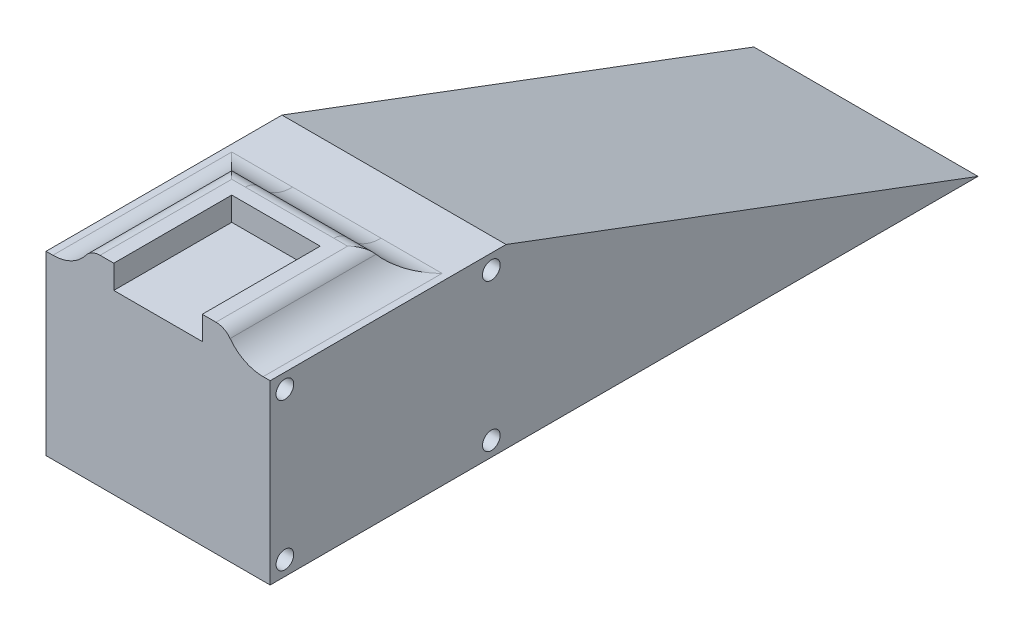
from build123d import *

# Parameters (mm, degrees)
BOSS_EXTRUDE1_DEPTH                = 38
F_3_0_3_DIAMETER_HOLE1_D           = 3
F_3_0_3_DIAMETER_HOLE1_CSINK_D     = 3.05
F_3_0_3_DIAMETER_HOLE1_CSINK_ANGLE = 90
SKETCH6_W                          = 4
SKETCH6_H                          = 4
BOSS_EXTRUDE2_DEPTH                = 24
FILLET2_R                          = 7
FILLET3_START                      = 7.489649075
FILLET3_DEPTH                      = 4
FILLET3_START_2                    = 26.489649075
FILLET3_2_DEPTH                    = 4
FILLET3_START_3                    = 1.165093755
FILLET3_3_DEPTH                    = 6.32455532
FILLET3_START_4                    = 30.489649075
FILLET3_4_DEPTH                    = 6.324555321
FILLET3_START_5                    = -11
FILLET3_5_DEPTH                    = 7
SKETCH7_W                          = 15
SKETCH7_H                          = 4
BOSS_EXTRUDE3_DEPTH                = 4
FILLET4_R                          = 7
FILLET5_R                          = 3


with BuildPart() as part:
    # Sketch1 → Boss-Extrude1 (new body)
    with BuildSketch(Plane(origin=(0, 0, 0), x_dir=(0, 0, -1), z_dir=(1, 0, 0))):
        Polygon((-20, 15), (20, 15), (100, -15), (20, -15), (-20, -15), align=None)
    extrude(amount=BOSS_EXTRUDE1_DEPTH)

    # Ø3.0 (3) Diameter Hole1 (through all)
    with Locations(Plane.ZY):
        with Locations((17.5, 12.5), (-17.5, 12.5), (-17.5, -12.5), (17.5, -12.5)):
            CounterSinkHole(F_3_0_3_DIAMETER_HOLE1_D / 2, F_3_0_3_DIAMETER_HOLE1_CSINK_D / 2, counter_sink_angle=F_3_0_3_DIAMETER_HOLE1_CSINK_ANGLE)

    # Sketch6 → Boss-Extrude2 (add)
    with BuildSketch(Plane.XY.offset(20)):
        with Locations((9.489649075, 17)):
            Rectangle(SKETCH6_W, SKETCH6_H)
        with Locations((28.489649075, 17)):
            Rectangle(SKETCH6_W, SKETCH6_H)
    extrude(amount=-BOSS_EXTRUDE2_DEPTH)

    # Fillet2
    # the kernel refuses this fillet: 7 mm, written as the material it adds along each edge
    with BuildSketch(Plane(origin=(30.489649075, 15, 20), x_dir=(1, 0, 0), z_dir=(0, 0, -1))) as fillet2_piece_1:
        with BuildLine():
            CenterArc((6.32455532, -7), FILLET2_R, 90, 64.623066475)
            Line((0, -4), (-0.126491106, -3.94))
            ThreePointArc((-0.126491106, -3.94), (-0.14, -2), (-0.14, 0))
            Line((-0.14, 0), (0, 0.14))
            Line((0, 0.14), (6.32455532, 0.14))
            Line((6.32455532, 0.14), (6.32455532, 0))
        make_face()
    extrude(amount=24)
    with BuildSketch(Plane(origin=(7.489649075, 15, 20), x_dir=(-1, 0, 0), z_dir=(0, 0, -1))) as fillet2_piece_2:
        with BuildLine():
            CenterArc((6.32455532, 7), FILLET2_R, 205.376933525, 64.623066475)
            Line((0, 4), (-0.126491106, 3.94))
            ThreePointArc((-0.126491106, 3.94), (-0.14, 2), (-0.14, 0))
            Line((-0.14, 0), (0, -0.14))
            Line((0, -0.14), (6.32455532, -0.14))
            Line((6.32455532, -0.14), (6.32455532, 0))
        make_face()
    extrude(amount=24)

    # Fillet3: read off the stored shape, not the designer's step
    # Fillet3 outline → Fillet3 (add)
    with BuildSketch(Plane.YZ.offset(FILLET3_START)):
        with BuildLine():
            Line((15, -4), (15, -10.32455532))
            ThreePointArc((15, -10.32455532), (16.083920217, -6.582897934), (19, -4))
            Line((19, -4), (15, -4))
        make_face()
    extrude(amount=FILLET3_DEPTH)

    # Fillet3 2 outline → Fillet3 2 (add)
    with BuildSketch(Plane.YZ.offset(FILLET3_START_2)):
        with BuildLine():
            Line((15, -4), (15, -10.32455532))
            ThreePointArc((15, -10.32455532), (16.083920217, -6.582897934), (19, -4))
            Line((19, -4), (15, -4))
        make_face()
    extrude(amount=FILLET3_2_DEPTH)

    # Fillet3 3 outline → Fillet3 3 (add)
    with BuildSketch(Plane.YZ.offset(FILLET3_START_3)):
        with BuildLine():
            Line((15, -4), (15, -10.32455532))
            ThreePointArc((15, -10.32455532), (16.083920217, -6.582897934), (19, -4))
            Line((19, -4), (15, -4))
        make_face()
    extrude(amount=FILLET3_3_DEPTH)

    # Fillet3 4 outline → Fillet3 4 (add)
    with BuildSketch(Plane.YZ.offset(FILLET3_START_4)):
        with BuildLine():
            Line((15, -4), (15, -10.32455532))
            ThreePointArc((15, -10.32455532), (16.083920217, -6.582897934), (19, -4))
            Line((19, -4), (15, -4))
        make_face()
    extrude(amount=FILLET3_4_DEPTH)

    # Fillet3 5 outline → Fillet3 5 (cut)
    with BuildSketch(Plane.XY.offset(FILLET3_START_5)):
        with BuildLine():
            Line((30.015307426, 20), (30.489649075, 19))
            ThreePointArc((30.489649075, 19), (33.072547009, 16.083920217), (36.814204396, 15))
            Line((36.814204396, 15), (36.814204396, 20))
            Line((36.814204396, 20), (30.015307426, 20))
        make_face()
        with BuildLine():
            Line((7.489649075, 19), (7.963990724, 20))
            Line((7.963990724, 20), (1.165093755, 20))
            Line((1.165093755, 20), (1.165093755, 15))
            ThreePointArc((1.165093755, 15), (4.906751142, 16.083920217), (7.489649075, 19))
        make_face()
    extrude(amount=FILLET3_5_DEPTH, mode=Mode.SUBTRACT)

    # Sketch7 → Boss-Extrude3 (add)
    with BuildSketch(Plane(origin=(0, 15, 0), x_dir=(1, 0, 0), z_dir=(0, 1, 0))):
        with Locations((18.989649075, 2)):
            Rectangle(SKETCH7_W, SKETCH7_H)
    extrude(amount=BOSS_EXTRUDE3_DEPTH)

    # Fillet4
    # the kernel refuses this fillet: 7 mm, written as the material it adds along each edge
    with BuildSketch(Plane(origin=(11.489649075, 15, -4), x_dir=(0, 0, -1), z_dir=(1, 0, 0))) as fillet4_piece_1:
        with BuildLine():
            CenterArc((6.32455532, 7), FILLET4_R, 205.376933525, 64.623066475)
            Line((0, 4), (-0.126491106, 3.94))
            ThreePointArc((-0.126491106, 3.94), (-0.14, 2), (-0.14, 0))
            Line((-0.14, 0), (0, -0.14))
            Line((0, -0.14), (6.32455532, -0.14))
            Line((6.32455532, -0.14), (6.32455532, 0))
        make_face()
    extrude(amount=15)

    # Fillet5
    # the kernel refuses this fillet: 3 mm, written as the material it takes off along each edge
    with BuildSketch(Plane(origin=(30.489649075, 19, 24.188611699), x_dir=(-1, 0, 0), z_dir=(0, 0, -1))) as fillet5_piece_1:
        with BuildLine():
            CenterArc((1.67544468, -3), FILLET5_R, 90, 53.130102354)
            ThreePointArc((-0.72455532, -1.2), (-0.332163903, -0.618182569), (0, 0))
            Line((0, 0), (1.67544468, 0))
        make_face()
    extrude(amount=32.377223398, mode=Mode.SUBTRACT)
    with BuildSketch(Plane(origin=(34.678260774, 19, -4), x_dir=(0, 0, 1), z_dir=(-1, 0, 0)), Plane(origin=(11.489649075, 19, -4), x_dir=(0, 0, 1), z_dir=(-1, 0, 0))) as fillet5_piece_2:
        with BuildLine():
            CenterArc((1.675444679, -3), FILLET5_R, 90, 53.130102349)
            ThreePointArc((-0.72455532, -1.2), (-0.332163903, -0.618182569), (0, 0))
            Line((0, 0), (1.675444679, 0))
        make_face()
    extrude(amount=8.188611699, mode=Mode.SUBTRACT)
    with BuildSketch(Plane(origin=(11.489649075, 19, -4), x_dir=(0, -0.8560559167430235, -0.5168832241515113), z_dir=(1, 0, 0))) as fillet5_piece_3:
        with BuildLine():
            CenterArc((1.702158502, -2.984924004), FILLET5_R, 95.74648206, 53.130102354)
            Line((-0.866009248, -1.434274331), (0, 0))
            ThreePointArc((0, 0), (0.700888795, -0.035177325), (1.40177759, 0))
        make_face()
    extrude(amount=15, mode=Mode.SUBTRACT)
    with BuildSketch(Plane(origin=(7.489649075, 19, 24.188611699), x_dir=(1, 0, 0), z_dir=(0, 0, -1))) as fillet5_piece_4:
        with BuildLine():
            CenterArc((1.67544468, 3), FILLET5_R, 216.869897646, 53.130102354)
            ThreePointArc((-0.72455532, 1.2), (-0.332163903, 0.618182569), (0, 0))
            Line((0, 0), (1.67544468, 0))
        make_face()
    extrude(amount=32.377223398, mode=Mode.SUBTRACT)


solid = part.part
